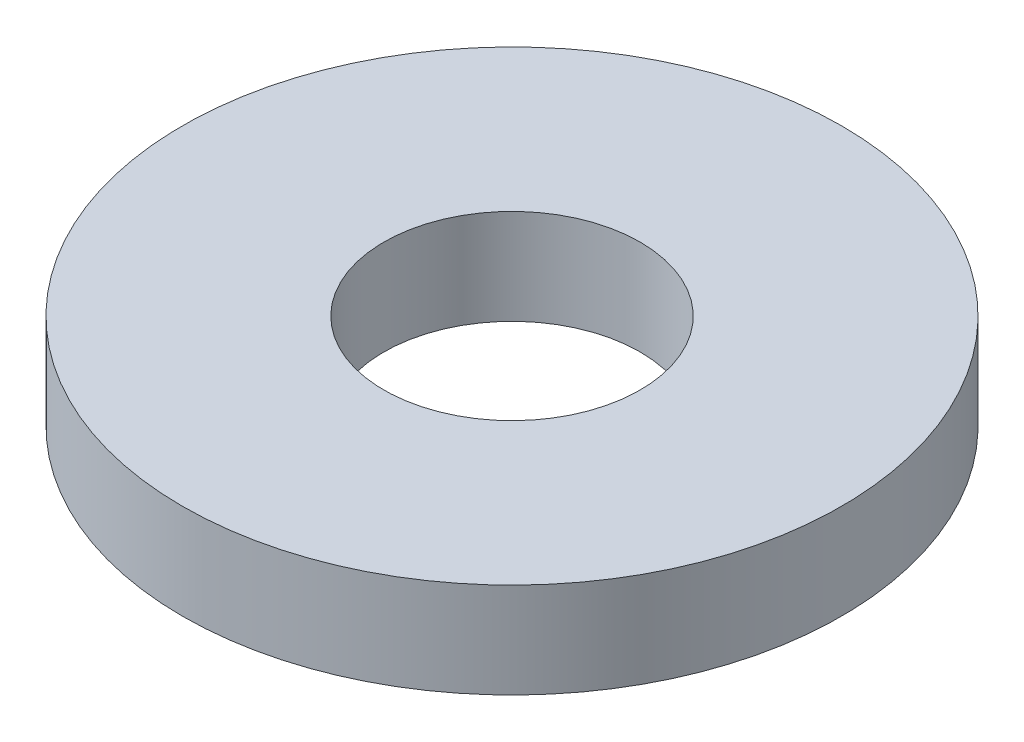
from build123d import *

# Parameters (mm, degrees)
SKETCH1_R           = 90
BOSS_EXTRUDE1_DEPTH = 26
SKETCH2_R           = 35
CUT_EXTRUDE1_DEPTH  = 130.907659512


with BuildPart() as part:
    # Sketch1 → Boss-Extrude1 (new body)
    with BuildSketch(Plane(origin=(0, 0, 0), x_dir=(1, 0, 0), z_dir=(0, 1, 0))):
        Circle(SKETCH1_R)
    extrude(amount=BOSS_EXTRUDE1_DEPTH)

    # Sketch2 → Cut-Extrude1 (cut, through all)
    with BuildSketch(Plane(origin=(0, 0, 0), x_dir=(1, 0, 0), z_dir=(0, 1, 0))):
        Circle(SKETCH2_R)
    extrude(amount=CUT_EXTRUDE1_DEPTH, mode=Mode.SUBTRACT)


solid = part.part
